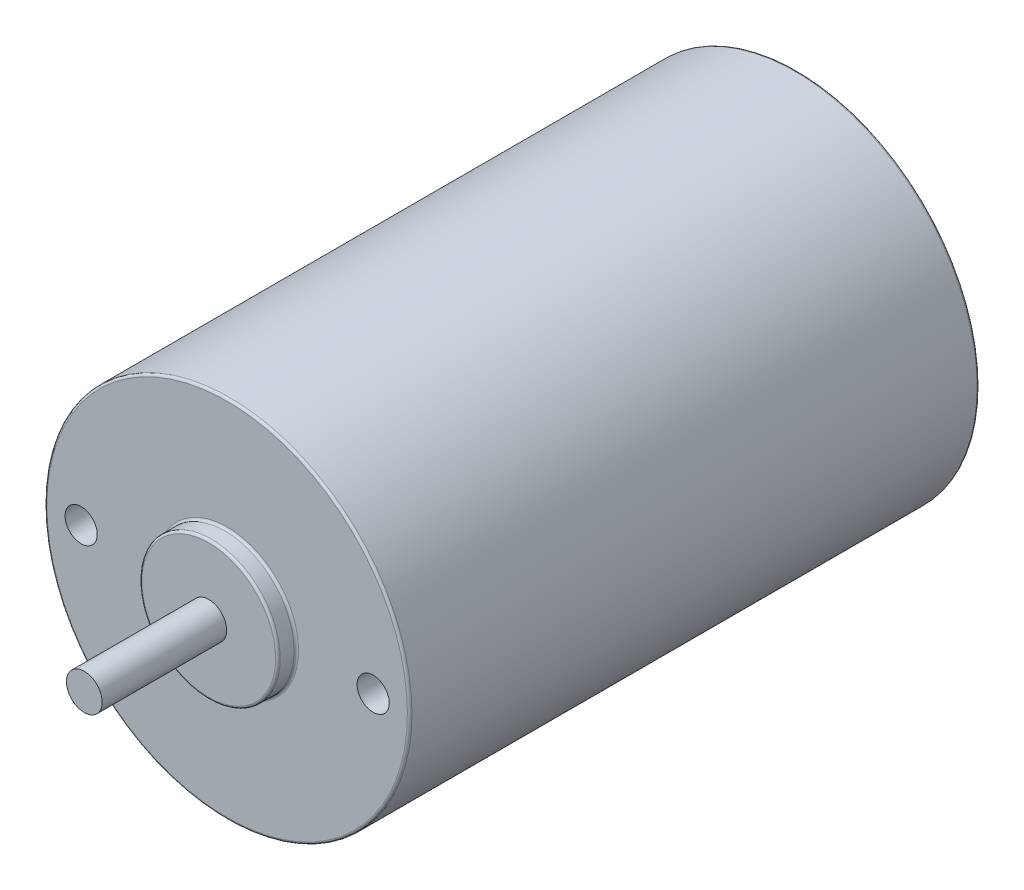
from build123d import *

# Parameters (mm, degrees)
SKETCH4_R             = 1.555
SHAFT_DEPTH           = 37.2
FILLET1_R             = 0.2
SKETCH6_R             = 1.4
F_6_32_THREADED_DEPTH = 5


with BuildPart() as part:
    # Sketch2 → body (revolve)
    with BuildSketch(Plane(origin=(0, 0, 0), x_dir=(1, 0, 0), z_dir=(0, 1, 0))):
        Polygon((1.55, -26.375), (1.55, 26.375), (6.015, 26.375), (6.015, 24.775), (15.875, 24.775), (15.875, -24.775), (6.015, -24.775), (6.015, -26.375), align=None)
    revolve(axis=Axis((0, 0, 0), (0, 0, -1)))

    # Sketch4 → shaft (add)
    with BuildSketch(Plane.XY):
        Circle(SKETCH4_R)
    extrude(amount=SHAFT_DEPTH)

    # Fillet1
    fillet1_edges = [part.edges().sort_by_distance(p)[0] for p in [
        (-15.875, 0, -24.775),
        (-6.015, 0, -24.775),
        (-6.015, 0, -26.375),
        (-15.875, 0, 24.775),
        (-6.015, 0, 24.775),
        (-6.015, 0, 26.375),
    ]]
    fillet(fillet1_edges, radius=FILLET1_R)

    # Sketch6 → #6-32 threaded (cut)
    with BuildSketch(Plane.XY.offset(24.775)):
        with Locations((-12.7, 0)):
            Circle(SKETCH6_R)
        with Locations((12.7, 0)):
            Circle(SKETCH6_R)
    extrude(amount=-F_6_32_THREADED_DEPTH, mode=Mode.SUBTRACT)


solid = part.part
